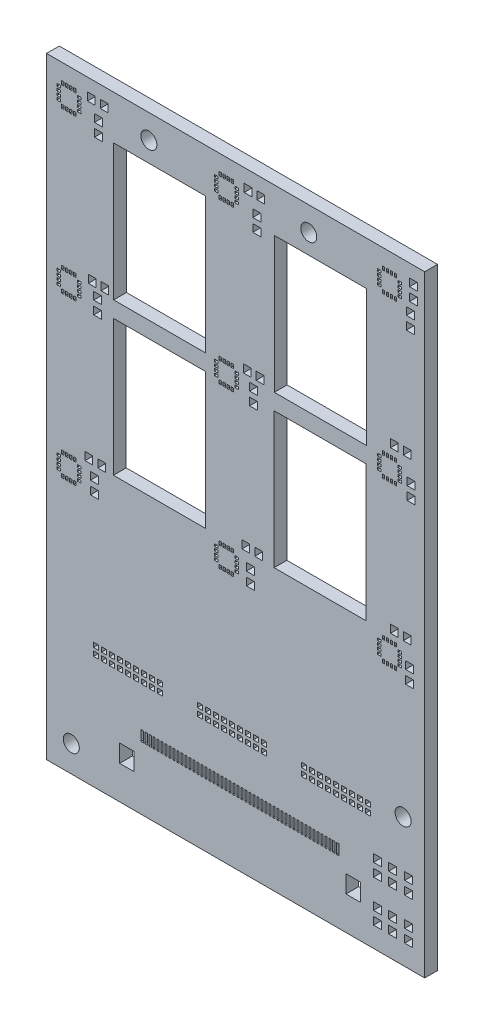
from build123d import *

# Parameters (mm, degrees)
MODEL_W                 = 47.3
MODEL_H                 = 76.5
MODEL_W_2               = 0.64
MODEL_H_2               = 0.59
MODEL_W_3               = 0.3
MODEL_H_3               = 1.3
MODEL_W_4               = 1.8
MODEL_H_4               = 2.2
MODEL_W_5               = 0.45
MODEL_H_5               = 0.3
MODEL_H_6               = 0.45
MODEL_W_6               = 1
MODEL_H_7               = 0.95
MODEL_W_7               = 0.95
MODEL_H_8               = 1
MODEL_W_8               = 11.5
MODEL_H_9               = 17
BOSS_EXTRU_1_DEPTH      = 1.6
ESQUISSE1_R             = 1
ENL_V_MAT_EXTRU_1_DEPTH = 10


with BuildPart() as part:
    # Model → Boss.-Extru.1 (new body)
    with BuildSketch(Plane.XY):
        with Locations((-0.55, 33.35)):
            Rectangle(MODEL_W, MODEL_H)
        with Locations((16, 10.48)):
            Rectangle(MODEL_W_2, MODEL_H_2, mode=Mode.SUBTRACT)
        with Locations((16, 9.52)):
            Rectangle(MODEL_W_2, MODEL_H_2, mode=Mode.SUBTRACT)
        with Locations((15, 10.48)):
            Rectangle(MODEL_W_2, MODEL_H_2, mode=Mode.SUBTRACT)
        with Locations((15, 9.52)):
            Rectangle(MODEL_W_2, MODEL_H_2, mode=Mode.SUBTRACT)
        with Locations((14, 10.48)):
            Rectangle(MODEL_W_2, MODEL_H_2, mode=Mode.SUBTRACT)
        with Locations((14, 9.52)):
            Rectangle(MODEL_W_2, MODEL_H_2, mode=Mode.SUBTRACT)
        with Locations((13, 10.48)):
            Rectangle(MODEL_W_2, MODEL_H_2, mode=Mode.SUBTRACT)
        with Locations((13, 9.52)):
            Rectangle(MODEL_W_2, MODEL_H_2, mode=Mode.SUBTRACT)
        with Locations((12, 10.48)):
            Rectangle(MODEL_W_2, MODEL_H_2, mode=Mode.SUBTRACT)
        with Locations((12, 9.52)):
            Rectangle(MODEL_W_2, MODEL_H_2, mode=Mode.SUBTRACT)
        with Locations((11, 10.48)):
            Rectangle(MODEL_W_2, MODEL_H_2, mode=Mode.SUBTRACT)
        with Locations((11, 9.52)):
            Rectangle(MODEL_W_2, MODEL_H_2, mode=Mode.SUBTRACT)
        with Locations((10, 10.48)):
            Rectangle(MODEL_W_2, MODEL_H_2, mode=Mode.SUBTRACT)
        with Locations((10, 9.52)):
            Rectangle(MODEL_W_2, MODEL_H_2, mode=Mode.SUBTRACT)
        with Locations((9, 10.48)):
            Rectangle(MODEL_W_2, MODEL_H_2, mode=Mode.SUBTRACT)
        with Locations((9, 9.52)):
            Rectangle(MODEL_W_2, MODEL_H_2, mode=Mode.SUBTRACT)
        with Locations((8, 10.48)):
            Rectangle(MODEL_W_2, MODEL_H_2, mode=Mode.SUBTRACT)
        with Locations((8, 9.52)):
            Rectangle(MODEL_W_2, MODEL_H_2, mode=Mode.SUBTRACT)
        with Locations((3, 10.48)):
            Rectangle(MODEL_W_2, MODEL_H_2, mode=Mode.SUBTRACT)
        with Locations((3, 9.52)):
            Rectangle(MODEL_W_2, MODEL_H_2, mode=Mode.SUBTRACT)
        with Locations((2, 10.48)):
            Rectangle(MODEL_W_2, MODEL_H_2, mode=Mode.SUBTRACT)
        with Locations((2, 9.52)):
            Rectangle(MODEL_W_2, MODEL_H_2, mode=Mode.SUBTRACT)
        with Locations((1, 10.48)):
            Rectangle(MODEL_W_2, MODEL_H_2, mode=Mode.SUBTRACT)
        with Locations((1, 9.52)):
            Rectangle(MODEL_W_2, MODEL_H_2, mode=Mode.SUBTRACT)
        with Locations((0, 10.48)):
            Rectangle(MODEL_W_2, MODEL_H_2, mode=Mode.SUBTRACT)
        with Locations((0, 9.52)):
            Rectangle(MODEL_W_2, MODEL_H_2, mode=Mode.SUBTRACT)
        with Locations((-1, 10.48)):
            Rectangle(MODEL_W_2, MODEL_H_2, mode=Mode.SUBTRACT)
        with Locations((-1, 9.52)):
            Rectangle(MODEL_W_2, MODEL_H_2, mode=Mode.SUBTRACT)
        with Locations((-2, 10.48)):
            Rectangle(MODEL_W_2, MODEL_H_2, mode=Mode.SUBTRACT)
        with Locations((-2, 9.52)):
            Rectangle(MODEL_W_2, MODEL_H_2, mode=Mode.SUBTRACT)
        with Locations((-3, 10.48)):
            Rectangle(MODEL_W_2, MODEL_H_2, mode=Mode.SUBTRACT)
        with Locations((-3, 9.52)):
            Rectangle(MODEL_W_2, MODEL_H_2, mode=Mode.SUBTRACT)
        with Locations((-4, 10.48)):
            Rectangle(MODEL_W_2, MODEL_H_2, mode=Mode.SUBTRACT)
        with Locations((-4, 9.52)):
            Rectangle(MODEL_W_2, MODEL_H_2, mode=Mode.SUBTRACT)
        with Locations((-5, 10.48)):
            Rectangle(MODEL_W_2, MODEL_H_2, mode=Mode.SUBTRACT)
        with Locations((-5, 9.52)):
            Rectangle(MODEL_W_2, MODEL_H_2, mode=Mode.SUBTRACT)
        with Locations((-10, 10.48)):
            Rectangle(MODEL_W_2, MODEL_H_2, mode=Mode.SUBTRACT)
        with Locations((-10, 9.52)):
            Rectangle(MODEL_W_2, MODEL_H_2, mode=Mode.SUBTRACT)
        with Locations((-11, 10.48)):
            Rectangle(MODEL_W_2, MODEL_H_2, mode=Mode.SUBTRACT)
        with Locations((-11, 9.52)):
            Rectangle(MODEL_W_2, MODEL_H_2, mode=Mode.SUBTRACT)
        with Locations((-12, 10.48)):
            Rectangle(MODEL_W_2, MODEL_H_2, mode=Mode.SUBTRACT)
        with Locations((-12, 9.52)):
            Rectangle(MODEL_W_2, MODEL_H_2, mode=Mode.SUBTRACT)
        with Locations((-13, 10.48)):
            Rectangle(MODEL_W_2, MODEL_H_2, mode=Mode.SUBTRACT)
        with Locations((-13, 9.52)):
            Rectangle(MODEL_W_2, MODEL_H_2, mode=Mode.SUBTRACT)
        with Locations((-14, 10.48)):
            Rectangle(MODEL_W_2, MODEL_H_2, mode=Mode.SUBTRACT)
        with Locations((-14, 9.52)):
            Rectangle(MODEL_W_2, MODEL_H_2, mode=Mode.SUBTRACT)
        with Locations((-15, 10.48)):
            Rectangle(MODEL_W_2, MODEL_H_2, mode=Mode.SUBTRACT)
        with Locations((-15, 9.52)):
            Rectangle(MODEL_W_2, MODEL_H_2, mode=Mode.SUBTRACT)
        with Locations((-16, 10.48)):
            Rectangle(MODEL_W_2, MODEL_H_2, mode=Mode.SUBTRACT)
        with Locations((-16, 9.52)):
            Rectangle(MODEL_W_2, MODEL_H_2, mode=Mode.SUBTRACT)
        with Locations((-17, 10.48)):
            Rectangle(MODEL_W_2, MODEL_H_2, mode=Mode.SUBTRACT)
        with Locations((-17, 9.52)):
            Rectangle(MODEL_W_2, MODEL_H_2, mode=Mode.SUBTRACT)
        with Locations((-18, 10.48)):
            Rectangle(MODEL_W_2, MODEL_H_2, mode=Mode.SUBTRACT)
        with Locations((-18, 9.52)):
            Rectangle(MODEL_W_2, MODEL_H_2, mode=Mode.SUBTRACT)
        with Locations((12.25, 3.625)):
            Rectangle(MODEL_W_3, MODEL_H_3, mode=Mode.SUBTRACT)
        with Locations((11.75, 3.625)):
            Rectangle(MODEL_W_3, MODEL_H_3, mode=Mode.SUBTRACT)
        with Locations((11.25, 3.625)):
            Rectangle(MODEL_W_3, MODEL_H_3, mode=Mode.SUBTRACT)
        with Locations((10.75, 3.625)):
            Rectangle(MODEL_W_3, MODEL_H_3, mode=Mode.SUBTRACT)
        with Locations((10.25, 3.625)):
            Rectangle(MODEL_W_3, MODEL_H_3, mode=Mode.SUBTRACT)
        with Locations((9.75, 3.625)):
            Rectangle(MODEL_W_3, MODEL_H_3, mode=Mode.SUBTRACT)
        with Locations((9.25, 3.625)):
            Rectangle(MODEL_W_3, MODEL_H_3, mode=Mode.SUBTRACT)
        with Locations((8.75, 3.625)):
            Rectangle(MODEL_W_3, MODEL_H_3, mode=Mode.SUBTRACT)
        with Locations((8.25, 3.625)):
            Rectangle(MODEL_W_3, MODEL_H_3, mode=Mode.SUBTRACT)
        with Locations((7.75, 3.625)):
            Rectangle(MODEL_W_3, MODEL_H_3, mode=Mode.SUBTRACT)
        with Locations((7.25, 3.625)):
            Rectangle(MODEL_W_3, MODEL_H_3, mode=Mode.SUBTRACT)
        with Locations((6.75, 3.625)):
            Rectangle(MODEL_W_3, MODEL_H_3, mode=Mode.SUBTRACT)
        with Locations((6.25, 3.625)):
            Rectangle(MODEL_W_3, MODEL_H_3, mode=Mode.SUBTRACT)
        with Locations((5.75, 3.625)):
            Rectangle(MODEL_W_3, MODEL_H_3, mode=Mode.SUBTRACT)
        with Locations((5.25, 3.625)):
            Rectangle(MODEL_W_3, MODEL_H_3, mode=Mode.SUBTRACT)
        with Locations((4.75, 3.625)):
            Rectangle(MODEL_W_3, MODEL_H_3, mode=Mode.SUBTRACT)
        with Locations((4.25, 3.625)):
            Rectangle(MODEL_W_3, MODEL_H_3, mode=Mode.SUBTRACT)
        with Locations((3.75, 3.625)):
            Rectangle(MODEL_W_3, MODEL_H_3, mode=Mode.SUBTRACT)
        with Locations((3.25, 3.625)):
            Rectangle(MODEL_W_3, MODEL_H_3, mode=Mode.SUBTRACT)
        with Locations((2.75, 3.625)):
            Rectangle(MODEL_W_3, MODEL_H_3, mode=Mode.SUBTRACT)
        with Locations((2.25, 3.625)):
            Rectangle(MODEL_W_3, MODEL_H_3, mode=Mode.SUBTRACT)
        with Locations((1.75, 3.625)):
            Rectangle(MODEL_W_3, MODEL_H_3, mode=Mode.SUBTRACT)
        with Locations((1.25, 3.625)):
            Rectangle(MODEL_W_3, MODEL_H_3, mode=Mode.SUBTRACT)
        with Locations((0.75, 3.625)):
            Rectangle(MODEL_W_3, MODEL_H_3, mode=Mode.SUBTRACT)
        with Locations((0.25, 3.625)):
            Rectangle(MODEL_W_3, MODEL_H_3, mode=Mode.SUBTRACT)
        with Locations((-0.25, 3.625)):
            Rectangle(MODEL_W_3, MODEL_H_3, mode=Mode.SUBTRACT)
        with Locations((-0.75, 3.625)):
            Rectangle(MODEL_W_3, MODEL_H_3, mode=Mode.SUBTRACT)
        with Locations((-1.25, 3.625)):
            Rectangle(MODEL_W_3, MODEL_H_3, mode=Mode.SUBTRACT)
        with Locations((-1.75, 3.625)):
            Rectangle(MODEL_W_3, MODEL_H_3, mode=Mode.SUBTRACT)
        with Locations((-2.25, 3.625)):
            Rectangle(MODEL_W_3, MODEL_H_3, mode=Mode.SUBTRACT)
        with Locations((-2.75, 3.625)):
            Rectangle(MODEL_W_3, MODEL_H_3, mode=Mode.SUBTRACT)
        with Locations((-3.25, 3.625)):
            Rectangle(MODEL_W_3, MODEL_H_3, mode=Mode.SUBTRACT)
        with Locations((-3.75, 3.625)):
            Rectangle(MODEL_W_3, MODEL_H_3, mode=Mode.SUBTRACT)
        with Locations((-4.25, 3.625)):
            Rectangle(MODEL_W_3, MODEL_H_3, mode=Mode.SUBTRACT)
        with Locations((-4.75, 3.625)):
            Rectangle(MODEL_W_3, MODEL_H_3, mode=Mode.SUBTRACT)
        with Locations((-5.25, 3.625)):
            Rectangle(MODEL_W_3, MODEL_H_3, mode=Mode.SUBTRACT)
        with Locations((-5.75, 3.625)):
            Rectangle(MODEL_W_3, MODEL_H_3, mode=Mode.SUBTRACT)
        with Locations((-6.25, 3.625)):
            Rectangle(MODEL_W_3, MODEL_H_3, mode=Mode.SUBTRACT)
        with Locations((-6.75, 3.625)):
            Rectangle(MODEL_W_3, MODEL_H_3, mode=Mode.SUBTRACT)
        with Locations((-7.25, 3.625)):
            Rectangle(MODEL_W_3, MODEL_H_3, mode=Mode.SUBTRACT)
        with Locations((-7.75, 3.625)):
            Rectangle(MODEL_W_3, MODEL_H_3, mode=Mode.SUBTRACT)
        with Locations((-8.25, 3.625)):
            Rectangle(MODEL_W_3, MODEL_H_3, mode=Mode.SUBTRACT)
        with Locations((-8.75, 3.625)):
            Rectangle(MODEL_W_3, MODEL_H_3, mode=Mode.SUBTRACT)
        with Locations((-9.25, 3.625)):
            Rectangle(MODEL_W_3, MODEL_H_3, mode=Mode.SUBTRACT)
        with Locations((-9.75, 3.625)):
            Rectangle(MODEL_W_3, MODEL_H_3, mode=Mode.SUBTRACT)
        with Locations((-10.25, 3.625)):
            Rectangle(MODEL_W_3, MODEL_H_3, mode=Mode.SUBTRACT)
        with Locations((-10.75, 3.625)):
            Rectangle(MODEL_W_3, MODEL_H_3, mode=Mode.SUBTRACT)
        with Locations((-11.25, 3.625)):
            Rectangle(MODEL_W_3, MODEL_H_3, mode=Mode.SUBTRACT)
        with Locations((-11.75, 3.625)):
            Rectangle(MODEL_W_3, MODEL_H_3, mode=Mode.SUBTRACT)
        with Locations((-12.25, 3.625)):
            Rectangle(MODEL_W_3, MODEL_H_3, mode=Mode.SUBTRACT)
        with Locations((14.15, 0.375)):
            Rectangle(MODEL_W_4, MODEL_H_4, mode=Mode.SUBTRACT)
        with Locations((-14.15, 0.375)):
            Rectangle(MODEL_W_4, MODEL_H_4, mode=Mode.SUBTRACT)
        with Locations((17.425, 28.85)):
            Rectangle(MODEL_W_5, MODEL_H_5, mode=Mode.SUBTRACT)
        with Locations((19.975, 27.85)):
            Rectangle(MODEL_W_5, MODEL_H_5, mode=Mode.SUBTRACT)
        with Locations((19.975, 28.35)):
            Rectangle(MODEL_W_5, MODEL_H_5, mode=Mode.SUBTRACT)
        with Locations((19.975, 28.85)):
            Rectangle(MODEL_W_5, MODEL_H_5, mode=Mode.SUBTRACT)
        with Locations((19.45, 29.375)):
            Rectangle(MODEL_W_3, MODEL_H_6, mode=Mode.SUBTRACT)
        with Locations((18.95, 29.375)):
            Rectangle(MODEL_W_3, MODEL_H_6, mode=Mode.SUBTRACT)
        with Locations((18.45, 29.375)):
            Rectangle(MODEL_W_3, MODEL_H_6, mode=Mode.SUBTRACT)
        with Locations((17.95, 29.375)):
            Rectangle(MODEL_W_3, MODEL_H_6, mode=Mode.SUBTRACT)
        with Locations((17.425, 28.35)):
            Rectangle(MODEL_W_5, MODEL_H_5, mode=Mode.SUBTRACT)
        with Locations((17.425, 27.85)):
            Rectangle(MODEL_W_5, MODEL_H_5, mode=Mode.SUBTRACT)
        with Locations((17.425, 27.35)):
            Rectangle(MODEL_W_5, MODEL_H_5, mode=Mode.SUBTRACT)
        with Locations((17.95, 26.825)):
            Rectangle(MODEL_W_3, MODEL_H_6, mode=Mode.SUBTRACT)
        with Locations((18.45, 26.825)):
            Rectangle(MODEL_W_3, MODEL_H_6, mode=Mode.SUBTRACT)
        with Locations((18.95, 26.825)):
            Rectangle(MODEL_W_3, MODEL_H_6, mode=Mode.SUBTRACT)
        with Locations((19.45, 26.825)):
            Rectangle(MODEL_W_3, MODEL_H_6, mode=Mode.SUBTRACT)
        with Locations((19.975, 27.35)):
            Rectangle(MODEL_W_5, MODEL_H_5, mode=Mode.SUBTRACT)
        with Locations((-2.975, 28.85)):
            Rectangle(MODEL_W_5, MODEL_H_5, mode=Mode.SUBTRACT)
        with Locations((-0.425, 27.85)):
            Rectangle(MODEL_W_5, MODEL_H_5, mode=Mode.SUBTRACT)
        with Locations((-0.425, 28.35)):
            Rectangle(MODEL_W_5, MODEL_H_5, mode=Mode.SUBTRACT)
        with Locations((-0.425, 28.85)):
            Rectangle(MODEL_W_5, MODEL_H_5, mode=Mode.SUBTRACT)
        with Locations((-0.95, 29.375)):
            Rectangle(MODEL_W_3, MODEL_H_6, mode=Mode.SUBTRACT)
        with Locations((-1.45, 29.375)):
            Rectangle(MODEL_W_3, MODEL_H_6, mode=Mode.SUBTRACT)
        with Locations((-1.95, 29.375)):
            Rectangle(MODEL_W_3, MODEL_H_6, mode=Mode.SUBTRACT)
        with Locations((-2.45, 29.375)):
            Rectangle(MODEL_W_3, MODEL_H_6, mode=Mode.SUBTRACT)
        with Locations((-2.975, 28.35)):
            Rectangle(MODEL_W_5, MODEL_H_5, mode=Mode.SUBTRACT)
        with Locations((-2.975, 27.85)):
            Rectangle(MODEL_W_5, MODEL_H_5, mode=Mode.SUBTRACT)
        with Locations((-2.975, 27.35)):
            Rectangle(MODEL_W_5, MODEL_H_5, mode=Mode.SUBTRACT)
        with Locations((-2.45, 26.825)):
            Rectangle(MODEL_W_3, MODEL_H_6, mode=Mode.SUBTRACT)
        with Locations((-1.95, 26.825)):
            Rectangle(MODEL_W_3, MODEL_H_6, mode=Mode.SUBTRACT)
        with Locations((-1.45, 26.825)):
            Rectangle(MODEL_W_3, MODEL_H_6, mode=Mode.SUBTRACT)
        with Locations((-0.95, 26.825)):
            Rectangle(MODEL_W_3, MODEL_H_6, mode=Mode.SUBTRACT)
        with Locations((-0.425, 27.35)):
            Rectangle(MODEL_W_5, MODEL_H_5, mode=Mode.SUBTRACT)
        with Locations((-22.675, 28.85)):
            Rectangle(MODEL_W_5, MODEL_H_5, mode=Mode.SUBTRACT)
        with Locations((-20.125, 27.85)):
            Rectangle(MODEL_W_5, MODEL_H_5, mode=Mode.SUBTRACT)
        with Locations((-20.125, 28.35)):
            Rectangle(MODEL_W_5, MODEL_H_5, mode=Mode.SUBTRACT)
        with Locations((-20.125, 28.85)):
            Rectangle(MODEL_W_5, MODEL_H_5, mode=Mode.SUBTRACT)
        with Locations((-20.65, 29.375)):
            Rectangle(MODEL_W_3, MODEL_H_6, mode=Mode.SUBTRACT)
        with Locations((-21.15, 29.375)):
            Rectangle(MODEL_W_3, MODEL_H_6, mode=Mode.SUBTRACT)
        with Locations((-21.65, 29.375)):
            Rectangle(MODEL_W_3, MODEL_H_6, mode=Mode.SUBTRACT)
        with Locations((-22.15, 29.375)):
            Rectangle(MODEL_W_3, MODEL_H_6, mode=Mode.SUBTRACT)
        with Locations((-22.675, 28.35)):
            Rectangle(MODEL_W_5, MODEL_H_5, mode=Mode.SUBTRACT)
        with Locations((-22.675, 27.85)):
            Rectangle(MODEL_W_5, MODEL_H_5, mode=Mode.SUBTRACT)
        with Locations((-22.675, 27.35)):
            Rectangle(MODEL_W_5, MODEL_H_5, mode=Mode.SUBTRACT)
        with Locations((-22.15, 26.825)):
            Rectangle(MODEL_W_3, MODEL_H_6, mode=Mode.SUBTRACT)
        with Locations((-21.65, 26.825)):
            Rectangle(MODEL_W_3, MODEL_H_6, mode=Mode.SUBTRACT)
        with Locations((-21.15, 26.825)):
            Rectangle(MODEL_W_3, MODEL_H_6, mode=Mode.SUBTRACT)
        with Locations((-20.65, 26.825)):
            Rectangle(MODEL_W_3, MODEL_H_6, mode=Mode.SUBTRACT)
        with Locations((-20.125, 27.35)):
            Rectangle(MODEL_W_5, MODEL_H_5, mode=Mode.SUBTRACT)
        with Locations((17.425, 68.85)):
            Rectangle(MODEL_W_5, MODEL_H_5, mode=Mode.SUBTRACT)
        with Locations((19.975, 67.85)):
            Rectangle(MODEL_W_5, MODEL_H_5, mode=Mode.SUBTRACT)
        with Locations((19.975, 68.35)):
            Rectangle(MODEL_W_5, MODEL_H_5, mode=Mode.SUBTRACT)
        with Locations((19.975, 68.85)):
            Rectangle(MODEL_W_5, MODEL_H_5, mode=Mode.SUBTRACT)
        with Locations((19.45, 69.375)):
            Rectangle(MODEL_W_3, MODEL_H_6, mode=Mode.SUBTRACT)
        with Locations((18.95, 69.375)):
            Rectangle(MODEL_W_3, MODEL_H_6, mode=Mode.SUBTRACT)
        with Locations((18.45, 69.375)):
            Rectangle(MODEL_W_3, MODEL_H_6, mode=Mode.SUBTRACT)
        with Locations((17.95, 69.375)):
            Rectangle(MODEL_W_3, MODEL_H_6, mode=Mode.SUBTRACT)
        with Locations((17.425, 68.35)):
            Rectangle(MODEL_W_5, MODEL_H_5, mode=Mode.SUBTRACT)
        with Locations((17.425, 67.85)):
            Rectangle(MODEL_W_5, MODEL_H_5, mode=Mode.SUBTRACT)
        with Locations((17.425, 67.35)):
            Rectangle(MODEL_W_5, MODEL_H_5, mode=Mode.SUBTRACT)
        with Locations((17.95, 66.825)):
            Rectangle(MODEL_W_3, MODEL_H_6, mode=Mode.SUBTRACT)
        with Locations((18.45, 66.825)):
            Rectangle(MODEL_W_3, MODEL_H_6, mode=Mode.SUBTRACT)
        with Locations((18.95, 66.825)):
            Rectangle(MODEL_W_3, MODEL_H_6, mode=Mode.SUBTRACT)
        with Locations((19.45, 66.825)):
            Rectangle(MODEL_W_3, MODEL_H_6, mode=Mode.SUBTRACT)
        with Locations((19.975, 67.35)):
            Rectangle(MODEL_W_5, MODEL_H_5, mode=Mode.SUBTRACT)
        with Locations((-2.975, 68.85)):
            Rectangle(MODEL_W_5, MODEL_H_5, mode=Mode.SUBTRACT)
        with Locations((-0.425, 67.85)):
            Rectangle(MODEL_W_5, MODEL_H_5, mode=Mode.SUBTRACT)
        with Locations((-0.425, 68.35)):
            Rectangle(MODEL_W_5, MODEL_H_5, mode=Mode.SUBTRACT)
        with Locations((-0.425, 68.85)):
            Rectangle(MODEL_W_5, MODEL_H_5, mode=Mode.SUBTRACT)
        with Locations((-0.95, 69.375)):
            Rectangle(MODEL_W_3, MODEL_H_6, mode=Mode.SUBTRACT)
        with Locations((-1.45, 69.375)):
            Rectangle(MODEL_W_3, MODEL_H_6, mode=Mode.SUBTRACT)
        with Locations((-1.95, 69.375)):
            Rectangle(MODEL_W_3, MODEL_H_6, mode=Mode.SUBTRACT)
        with Locations((-2.45, 69.375)):
            Rectangle(MODEL_W_3, MODEL_H_6, mode=Mode.SUBTRACT)
        with Locations((-2.975, 68.35)):
            Rectangle(MODEL_W_5, MODEL_H_5, mode=Mode.SUBTRACT)
        with Locations((-2.975, 67.85)):
            Rectangle(MODEL_W_5, MODEL_H_5, mode=Mode.SUBTRACT)
        with Locations((-2.975, 67.35)):
            Rectangle(MODEL_W_5, MODEL_H_5, mode=Mode.SUBTRACT)
        with Locations((-2.45, 66.825)):
            Rectangle(MODEL_W_3, MODEL_H_6, mode=Mode.SUBTRACT)
        with Locations((-1.95, 66.825)):
            Rectangle(MODEL_W_3, MODEL_H_6, mode=Mode.SUBTRACT)
        with Locations((-1.45, 66.825)):
            Rectangle(MODEL_W_3, MODEL_H_6, mode=Mode.SUBTRACT)
        with Locations((-0.95, 66.825)):
            Rectangle(MODEL_W_3, MODEL_H_6, mode=Mode.SUBTRACT)
        with Locations((-0.425, 67.35)):
            Rectangle(MODEL_W_5, MODEL_H_5, mode=Mode.SUBTRACT)
        with Locations((-22.675, 68.85)):
            Rectangle(MODEL_W_5, MODEL_H_5, mode=Mode.SUBTRACT)
        with Locations((-20.125, 67.85)):
            Rectangle(MODEL_W_5, MODEL_H_5, mode=Mode.SUBTRACT)
        with Locations((-20.125, 68.35)):
            Rectangle(MODEL_W_5, MODEL_H_5, mode=Mode.SUBTRACT)
        with Locations((-20.125, 68.85)):
            Rectangle(MODEL_W_5, MODEL_H_5, mode=Mode.SUBTRACT)
        with Locations((-20.65, 69.375)):
            Rectangle(MODEL_W_3, MODEL_H_6, mode=Mode.SUBTRACT)
        with Locations((-21.15, 69.375)):
            Rectangle(MODEL_W_3, MODEL_H_6, mode=Mode.SUBTRACT)
        with Locations((-21.65, 69.375)):
            Rectangle(MODEL_W_3, MODEL_H_6, mode=Mode.SUBTRACT)
        with Locations((-22.15, 69.375)):
            Rectangle(MODEL_W_3, MODEL_H_6, mode=Mode.SUBTRACT)
        with Locations((-22.675, 68.35)):
            Rectangle(MODEL_W_5, MODEL_H_5, mode=Mode.SUBTRACT)
        with Locations((-22.675, 67.85)):
            Rectangle(MODEL_W_5, MODEL_H_5, mode=Mode.SUBTRACT)
        with Locations((-22.675, 67.35)):
            Rectangle(MODEL_W_5, MODEL_H_5, mode=Mode.SUBTRACT)
        with Locations((-22.15, 66.825)):
            Rectangle(MODEL_W_3, MODEL_H_6, mode=Mode.SUBTRACT)
        with Locations((-21.65, 66.825)):
            Rectangle(MODEL_W_3, MODEL_H_6, mode=Mode.SUBTRACT)
        with Locations((-21.15, 66.825)):
            Rectangle(MODEL_W_3, MODEL_H_6, mode=Mode.SUBTRACT)
        with Locations((-20.65, 66.825)):
            Rectangle(MODEL_W_3, MODEL_H_6, mode=Mode.SUBTRACT)
        with Locations((-20.125, 67.35)):
            Rectangle(MODEL_W_5, MODEL_H_5, mode=Mode.SUBTRACT)
        with Locations((17.425, 48.85)):
            Rectangle(MODEL_W_5, MODEL_H_5, mode=Mode.SUBTRACT)
        with Locations((19.975, 47.85)):
            Rectangle(MODEL_W_5, MODEL_H_5, mode=Mode.SUBTRACT)
        with Locations((19.975, 48.35)):
            Rectangle(MODEL_W_5, MODEL_H_5, mode=Mode.SUBTRACT)
        with Locations((19.975, 48.85)):
            Rectangle(MODEL_W_5, MODEL_H_5, mode=Mode.SUBTRACT)
        with Locations((19.45, 49.375)):
            Rectangle(MODEL_W_3, MODEL_H_6, mode=Mode.SUBTRACT)
        with Locations((18.95, 49.375)):
            Rectangle(MODEL_W_3, MODEL_H_6, mode=Mode.SUBTRACT)
        with Locations((18.45, 49.375)):
            Rectangle(MODEL_W_3, MODEL_H_6, mode=Mode.SUBTRACT)
        with Locations((17.95, 49.375)):
            Rectangle(MODEL_W_3, MODEL_H_6, mode=Mode.SUBTRACT)
        with Locations((17.425, 48.35)):
            Rectangle(MODEL_W_5, MODEL_H_5, mode=Mode.SUBTRACT)
        with Locations((17.425, 47.85)):
            Rectangle(MODEL_W_5, MODEL_H_5, mode=Mode.SUBTRACT)
        with Locations((17.425, 47.35)):
            Rectangle(MODEL_W_5, MODEL_H_5, mode=Mode.SUBTRACT)
        with Locations((17.95, 46.825)):
            Rectangle(MODEL_W_3, MODEL_H_6, mode=Mode.SUBTRACT)
        with Locations((18.45, 46.825)):
            Rectangle(MODEL_W_3, MODEL_H_6, mode=Mode.SUBTRACT)
        with Locations((18.95, 46.825)):
            Rectangle(MODEL_W_3, MODEL_H_6, mode=Mode.SUBTRACT)
        with Locations((19.45, 46.825)):
            Rectangle(MODEL_W_3, MODEL_H_6, mode=Mode.SUBTRACT)
        with Locations((19.975, 47.35)):
            Rectangle(MODEL_W_5, MODEL_H_5, mode=Mode.SUBTRACT)
        with Locations((-2.975, 48.85)):
            Rectangle(MODEL_W_5, MODEL_H_5, mode=Mode.SUBTRACT)
        with Locations((-0.425, 47.85)):
            Rectangle(MODEL_W_5, MODEL_H_5, mode=Mode.SUBTRACT)
        with Locations((-0.425, 48.35)):
            Rectangle(MODEL_W_5, MODEL_H_5, mode=Mode.SUBTRACT)
        with Locations((-0.425, 48.85)):
            Rectangle(MODEL_W_5, MODEL_H_5, mode=Mode.SUBTRACT)
        with Locations((-0.95, 49.375)):
            Rectangle(MODEL_W_3, MODEL_H_6, mode=Mode.SUBTRACT)
        with Locations((-1.45, 49.375)):
            Rectangle(MODEL_W_3, MODEL_H_6, mode=Mode.SUBTRACT)
        with Locations((-1.95, 49.375)):
            Rectangle(MODEL_W_3, MODEL_H_6, mode=Mode.SUBTRACT)
        with Locations((-2.45, 49.375)):
            Rectangle(MODEL_W_3, MODEL_H_6, mode=Mode.SUBTRACT)
        with Locations((-2.975, 48.35)):
            Rectangle(MODEL_W_5, MODEL_H_5, mode=Mode.SUBTRACT)
        with Locations((-2.975, 47.85)):
            Rectangle(MODEL_W_5, MODEL_H_5, mode=Mode.SUBTRACT)
        with Locations((-2.975, 47.35)):
            Rectangle(MODEL_W_5, MODEL_H_5, mode=Mode.SUBTRACT)
        with Locations((-2.45, 46.825)):
            Rectangle(MODEL_W_3, MODEL_H_6, mode=Mode.SUBTRACT)
        with Locations((-1.95, 46.825)):
            Rectangle(MODEL_W_3, MODEL_H_6, mode=Mode.SUBTRACT)
        with Locations((-1.45, 46.825)):
            Rectangle(MODEL_W_3, MODEL_H_6, mode=Mode.SUBTRACT)
        with Locations((-0.95, 46.825)):
            Rectangle(MODEL_W_3, MODEL_H_6, mode=Mode.SUBTRACT)
        with Locations((-0.425, 47.35)):
            Rectangle(MODEL_W_5, MODEL_H_5, mode=Mode.SUBTRACT)
        with Locations((-22.675, 48.85)):
            Rectangle(MODEL_W_5, MODEL_H_5, mode=Mode.SUBTRACT)
        with Locations((-20.125, 47.85)):
            Rectangle(MODEL_W_5, MODEL_H_5, mode=Mode.SUBTRACT)
        with Locations((-20.125, 48.35)):
            Rectangle(MODEL_W_5, MODEL_H_5, mode=Mode.SUBTRACT)
        with Locations((-20.125, 48.85)):
            Rectangle(MODEL_W_5, MODEL_H_5, mode=Mode.SUBTRACT)
        with Locations((-20.65, 49.375)):
            Rectangle(MODEL_W_3, MODEL_H_6, mode=Mode.SUBTRACT)
        with Locations((-21.15, 49.375)):
            Rectangle(MODEL_W_3, MODEL_H_6, mode=Mode.SUBTRACT)
        with Locations((-21.65, 49.375)):
            Rectangle(MODEL_W_3, MODEL_H_6, mode=Mode.SUBTRACT)
        with Locations((-22.15, 49.375)):
            Rectangle(MODEL_W_3, MODEL_H_6, mode=Mode.SUBTRACT)
        with Locations((-22.675, 48.35)):
            Rectangle(MODEL_W_5, MODEL_H_5, mode=Mode.SUBTRACT)
        with Locations((-22.675, 47.85)):
            Rectangle(MODEL_W_5, MODEL_H_5, mode=Mode.SUBTRACT)
        with Locations((-22.675, 47.35)):
            Rectangle(MODEL_W_5, MODEL_H_5, mode=Mode.SUBTRACT)
        with Locations((-22.15, 46.825)):
            Rectangle(MODEL_W_3, MODEL_H_6, mode=Mode.SUBTRACT)
        with Locations((-21.65, 46.825)):
            Rectangle(MODEL_W_3, MODEL_H_6, mode=Mode.SUBTRACT)
        with Locations((-21.15, 46.825)):
            Rectangle(MODEL_W_3, MODEL_H_6, mode=Mode.SUBTRACT)
        with Locations((-20.65, 46.825)):
            Rectangle(MODEL_W_3, MODEL_H_6, mode=Mode.SUBTRACT)
        with Locations((-20.125, 47.35)):
            Rectangle(MODEL_W_5, MODEL_H_5, mode=Mode.SUBTRACT)
        with Locations((21.1, 4.9)):
            Rectangle(MODEL_W_6, MODEL_H_7, mode=Mode.SUBTRACT)
        with Locations((21.1, 3.3)):
            Rectangle(MODEL_W_6, MODEL_H_7, mode=Mode.SUBTRACT)
        with Locations((19.1, 4.9)):
            Rectangle(MODEL_W_6, MODEL_H_7, mode=Mode.SUBTRACT)
        with Locations((19.1, 3.3)):
            Rectangle(MODEL_W_6, MODEL_H_7, mode=Mode.SUBTRACT)
        with Locations((17.2, 4.9)):
            Rectangle(MODEL_W_6, MODEL_H_7, mode=Mode.SUBTRACT)
        with Locations((17.2, 3.3)):
            Rectangle(MODEL_W_6, MODEL_H_7, mode=Mode.SUBTRACT)
        with Locations((17.2, -0.3)):
            Rectangle(MODEL_W_6, MODEL_H_7, mode=Mode.SUBTRACT)
        with Locations((17.2, -1.9)):
            Rectangle(MODEL_W_6, MODEL_H_7, mode=Mode.SUBTRACT)
        with Locations((19.1, -0.3)):
            Rectangle(MODEL_W_6, MODEL_H_7, mode=Mode.SUBTRACT)
        with Locations((19.1, -1.9)):
            Rectangle(MODEL_W_6, MODEL_H_7, mode=Mode.SUBTRACT)
        with Locations((21.1, -0.3)):
            Rectangle(MODEL_W_6, MODEL_H_7, mode=Mode.SUBTRACT)
        with Locations((21.1, -1.9)):
            Rectangle(MODEL_W_6, MODEL_H_7, mode=Mode.SUBTRACT)
        with Locations((21.2, 27.8)):
            Rectangle(MODEL_W_6, MODEL_H_7, mode=Mode.SUBTRACT)
        with Locations((21.2, 26.2)):
            Rectangle(MODEL_W_6, MODEL_H_7, mode=Mode.SUBTRACT)
        with Locations((19.3, 30.8)):
            Rectangle(MODEL_W_7, MODEL_H_8, mode=Mode.SUBTRACT)
        with Locations((20.9, 30.8)):
            Rectangle(MODEL_W_7, MODEL_H_8, mode=Mode.SUBTRACT)
        with Locations((1.3, 28.5)):
            Rectangle(MODEL_W_6, MODEL_H_7, mode=Mode.SUBTRACT)
        with Locations((1.3, 26.9)):
            Rectangle(MODEL_W_6, MODEL_H_7, mode=Mode.SUBTRACT)
        with Locations((0.72, 30.65)):
            Rectangle(MODEL_W_7, MODEL_H_8, mode=Mode.SUBTRACT)
        with Locations((2.32, 30.65)):
            Rectangle(MODEL_W_7, MODEL_H_8, mode=Mode.SUBTRACT)
        with Locations((-18.2, 28.6)):
            Rectangle(MODEL_W_6, MODEL_H_7, mode=Mode.SUBTRACT)
        with Locations((-18.2, 27)):
            Rectangle(MODEL_W_6, MODEL_H_7, mode=Mode.SUBTRACT)
        with Locations((-18.9, 30.4)):
            Rectangle(MODEL_W_7, MODEL_H_8, mode=Mode.SUBTRACT)
        with Locations((-17.3, 30.4)):
            Rectangle(MODEL_W_7, MODEL_H_8, mode=Mode.SUBTRACT)
        with Locations((21.4, 47.8)):
            Rectangle(MODEL_W_6, MODEL_H_7, mode=Mode.SUBTRACT)
        with Locations((21.4, 46.2)):
            Rectangle(MODEL_W_6, MODEL_H_7, mode=Mode.SUBTRACT)
        with Locations((19.3, 50.9)):
            Rectangle(MODEL_W_7, MODEL_H_8, mode=Mode.SUBTRACT)
        with Locations((20.9, 50.9)):
            Rectangle(MODEL_W_7, MODEL_H_8, mode=Mode.SUBTRACT)
        with Locations((1.7, 48.2)):
            Rectangle(MODEL_W_6, MODEL_H_7, mode=Mode.SUBTRACT)
        with Locations((1.7, 46.6)):
            Rectangle(MODEL_W_6, MODEL_H_7, mode=Mode.SUBTRACT)
        with Locations((0.9, 49.8)):
            Rectangle(MODEL_W_7, MODEL_H_8, mode=Mode.SUBTRACT)
        with Locations((2.5, 49.8)):
            Rectangle(MODEL_W_7, MODEL_H_8, mode=Mode.SUBTRACT)
        with Locations((2.1, 67.2)):
            Rectangle(MODEL_W_6, MODEL_H_7, mode=Mode.SUBTRACT)
        with Locations((2.1, 65.6)):
            Rectangle(MODEL_W_6, MODEL_H_7, mode=Mode.SUBTRACT)
        with Locations((1, 69.4)):
            Rectangle(MODEL_W_7, MODEL_H_8, mode=Mode.SUBTRACT)
        with Locations((2.6, 69.4)):
            Rectangle(MODEL_W_7, MODEL_H_8, mode=Mode.SUBTRACT)
        with Locations((21.3, 66.2)):
            Rectangle(MODEL_W_6, MODEL_H_7, mode=Mode.SUBTRACT)
        with Locations((21.3, 64.6)):
            Rectangle(MODEL_W_6, MODEL_H_7, mode=Mode.SUBTRACT)
        with Locations((21.7, 69.5)):
            Rectangle(MODEL_W_6, MODEL_H_7, mode=Mode.SUBTRACT)
        with Locations((21.7, 67.9)):
            Rectangle(MODEL_W_6, MODEL_H_7, mode=Mode.SUBTRACT)
        with Locations((-17.7, 67.6)):
            Rectangle(MODEL_W_6, MODEL_H_7, mode=Mode.SUBTRACT)
        with Locations((-17.7, 66)):
            Rectangle(MODEL_W_6, MODEL_H_7, mode=Mode.SUBTRACT)
        with Locations((-18.6, 69.5)):
            Rectangle(MODEL_W_7, MODEL_H_8, mode=Mode.SUBTRACT)
        with Locations((-17, 69.5)):
            Rectangle(MODEL_W_7, MODEL_H_8, mode=Mode.SUBTRACT)
        with Locations((-17.8, 48.3)):
            Rectangle(MODEL_W_6, MODEL_H_7, mode=Mode.SUBTRACT)
        with Locations((-17.8, 46.7)):
            Rectangle(MODEL_W_6, MODEL_H_7, mode=Mode.SUBTRACT)
        with Locations((-18.5, 49.8)):
            Rectangle(MODEL_W_7, MODEL_H_8, mode=Mode.SUBTRACT)
        with Locations((-16.9, 49.8)):
            Rectangle(MODEL_W_7, MODEL_H_8, mode=Mode.SUBTRACT)
        with Locations((10.0145, 38.6267)):
            Rectangle(MODEL_W_8, MODEL_H_9, mode=Mode.SUBTRACT)
        with Locations((-10.0809, 38.5898)):
            Rectangle(MODEL_W_8, MODEL_H_9, mode=Mode.SUBTRACT)
        with Locations((10.0454, 57.6369)):
            Rectangle(MODEL_W_8, MODEL_H_9, mode=Mode.SUBTRACT)
        with Locations((-10.05, 57.6)):
            Rectangle(MODEL_W_8, MODEL_H_9, mode=Mode.SUBTRACT)
    extrude(amount=BOSS_EXTRU_1_DEPTH)

    # Esquisse1 → Enlèv. mat.-Extru.1 (cut)
    with BuildSketch(Plane.XY.offset(1.6)):
        with Locations((20.4, 11.2)):
            Circle(ESQUISSE1_R)
        with Locations((-21.1, -1.6)):
            Circle(ESQUISSE1_R)
        with Locations((8.6, 68.6)):
            Circle(ESQUISSE1_R)
        with Locations((-11.4, 68.6)):
            Circle(ESQUISSE1_R)
    extrude(amount=-ENL_V_MAT_EXTRU_1_DEPTH, mode=Mode.SUBTRACT)


solid = part.part
